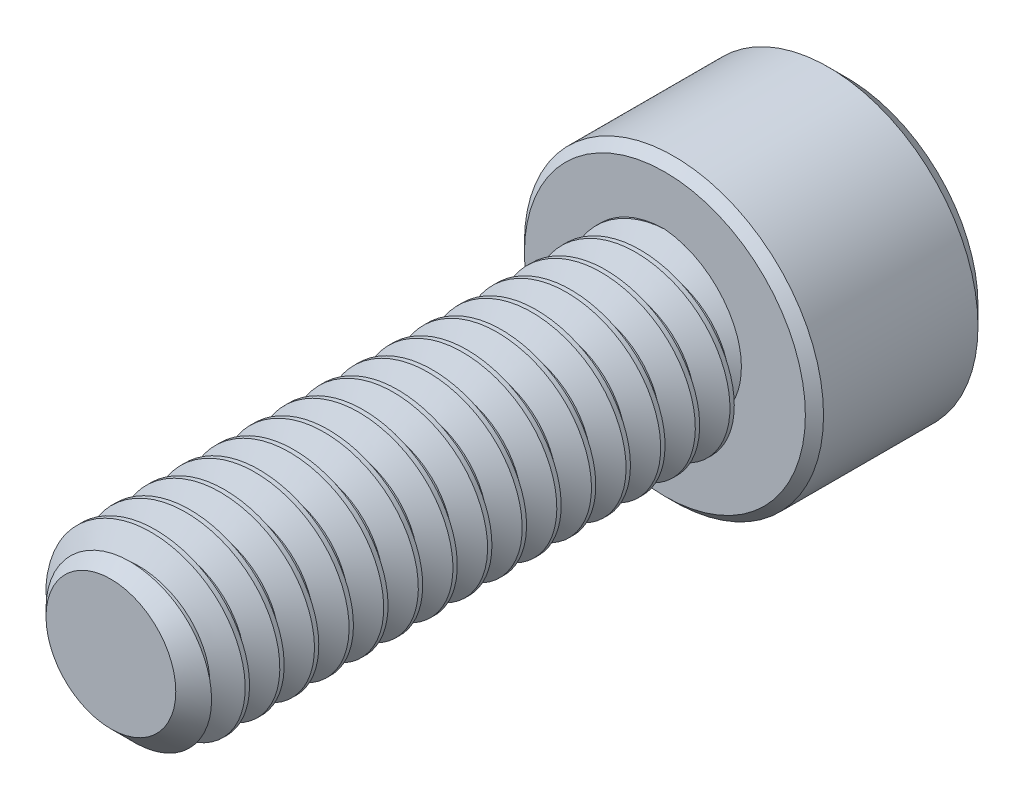
from build123d import *

# Parameters (mm, degrees)
SKETCH1_R          = 2.0828
EXTRUDE1_DEPTH     = 12.7
CHAMFER3_SIZE      = 0.5953125
CUT_SWEEP1_PITCH   = 0.79375
SKETCH6_R          = 3.429
EXTRUDE2_DEPTH     = 4.1656
CUT_EXTRUDE1_DEPTH = 2.67890625
SKETCH8_R          = 2.062222993
CUT_EXTRUDE2_DEPTH = 0.41656
CUT_EXTRUDE2_DRAFT = -45
CHAMFER1_SIZE      = 0.41656
CHAMFER2_SIZE      = 0.20828


with BuildPart() as part:
    # Sketch1 → Extrude1 (new body)
    with BuildSketch(Plane.XY):
        Circle(SKETCH1_R)
    extrude(amount=-EXTRUDE1_DEPTH)

    # Chamfer3
    chamfer3_edges = [part.edges().sort_by_distance(p)[0] for p in [
        (-2.0828, 0, 0),
    ]]
    chamfer(chamfer3_edges, length=CHAMFER3_SIZE)

    # Cut-Sweep1: the profile of Sketch3 profile screwed along a right-hand helix of 17 turns, 6 arcs to a turn; built about Z, then put on its axis
    cut_sweep1_z = Axis((0, 0, 0), (0, 0, 1))
    cut_sweep1_corners = [(2.0831, 0, -0.694704455), (1.567244252, 0, -0.396875), (1.567244252, 0, -0.29765625), (2.0831, 0, 0.000173205)]
    with BuildLine(mode=Mode.PRIVATE) as cut_sweep1_profile:
        Line(cut_sweep1_corners[0], cut_sweep1_corners[1])
        Line(cut_sweep1_corners[1], cut_sweep1_corners[2])
        Line(cut_sweep1_corners[2], cut_sweep1_corners[3])
        Line(cut_sweep1_corners[3], cut_sweep1_corners[0])
    cut_sweep1_cap = Face(cut_sweep1_profile.wire())
    cut_sweep1_turn_angles = [0, 30, 60, 90, 120, 150, 180, 210, 240, 270, 300, 330, 360]
    cut_sweep1_turn_weights = [1, 0.8660254037844387, 1, 0.8660254037844387, 1, 0.8660254037844387, 1, 0.8660254037844387, 1, 0.8660254037844387, 1, 0.8660254037844387, 1]
    cut_sweep1_turn_rails = [Edge.make_bspline([Vector(p[0], p[1], 0).rotate(cut_sweep1_z, cut_sweep1_turn_angles[k]) / cut_sweep1_turn_weights[k] + Vector(0, 0, p[2] + CUT_SWEEP1_PITCH * cut_sweep1_turn_angles[k] / 360) for k in range(13)], [0, 0, 0, 1, 1, 2, 2, 3, 3, 4, 4, 5, 5, 6, 6, 6], 2, cut_sweep1_turn_weights) for p in cut_sweep1_corners]
    cut_sweep1_turn_sides = [Face.make_surface_from_curves(cut_sweep1_turn_rails[p[0]], cut_sweep1_turn_rails[p[1]]) for p in [(0, 1), (1, 2), (2, 3), (3, 0)]]
    cut_sweep1 = Plane(origin=(0, 0, 0), x_dir=(0, 1, 0), z_dir=(0, 0, -1)) * Solid(Shell([*[p.moved(Location((0, 0, CUT_SWEEP1_PITCH * i))) for i in range(17) for p in cut_sweep1_turn_sides], cut_sweep1_cap, cut_sweep1_cap.rotate(cut_sweep1_z, 6120).moved(Location((0, 0, CUT_SWEEP1_PITCH * 6120 / 360)))]))
    add(cut_sweep1, mode=Mode.SUBTRACT)

    # Sketch6 → Extrude2 (add)
    with BuildSketch(Plane(origin=(0, 0, -12.7), x_dir=(-1, 0, 0), z_dir=(0, 0, -1))):
        Circle(SKETCH6_R)
    extrude(amount=EXTRUDE2_DEPTH)

    # Sketch7 → Cut-Extrude1 (cut)
    with BuildSketch(Plane(origin=(0, 0, -16.8656), x_dir=(-1, 0, 0), z_dir=(0, 0, -1))):
        Polygon((0, 2.062222993), (-1.7859375, 1.031111496), (-1.7859375, -1.031111496), (0, -2.062222993), (1.7859375, -1.031111496), (1.7859375, 1.031111496), align=None)
    extrude(amount=-CUT_EXTRUDE1_DEPTH, mode=Mode.SUBTRACT)


with BuildPart() as cut_extrude2_tool:
    # Sketch8 → Cut-Extrude2 (with draft: the straight prism first)
    with BuildSketch(Plane(origin=(0, 0, -16.8656), x_dir=(-1, 0, 0), z_dir=(0, 0, -1))):
        Circle(SKETCH8_R)
    extrude(amount=-CUT_EXTRUDE2_DEPTH)
    # Cut-Extrude2: the draft: its side faces are tilted about the plane it starts from
    cut_extrude2_sides = [cut_extrude2_tool.faces().sort_by_distance(p)[0] for p in [
        (2.062222993, 0, -16.65732),
    ]]
    draft(cut_extrude2_sides, Plane(origin=(0, 0, -16.8656), x_dir=(-1, 0, 0), z_dir=(0, 0, -1)), CUT_EXTRUDE2_DRAFT)


with BuildPart() as part_1:
    add(part.part)

    # Cut-Extrude2: cut by cut_extrude2_tool
    add(cut_extrude2_tool.part, mode=Mode.SUBTRACT)

    # Chamfer1
    chamfer1_edges = [part_1.edges().sort_by_distance(p)[0] for p in [
        (3.429, 0, -16.8656),
    ]]
    chamfer(chamfer1_edges, length=CHAMFER1_SIZE)

    # Chamfer2
    chamfer2_edges = [part_1.edges().sort_by_distance(p)[0] for p in [
        (3.429, 0, -12.7),
    ]]
    chamfer(chamfer2_edges, length=CHAMFER2_SIZE)


solid = part_1.part
